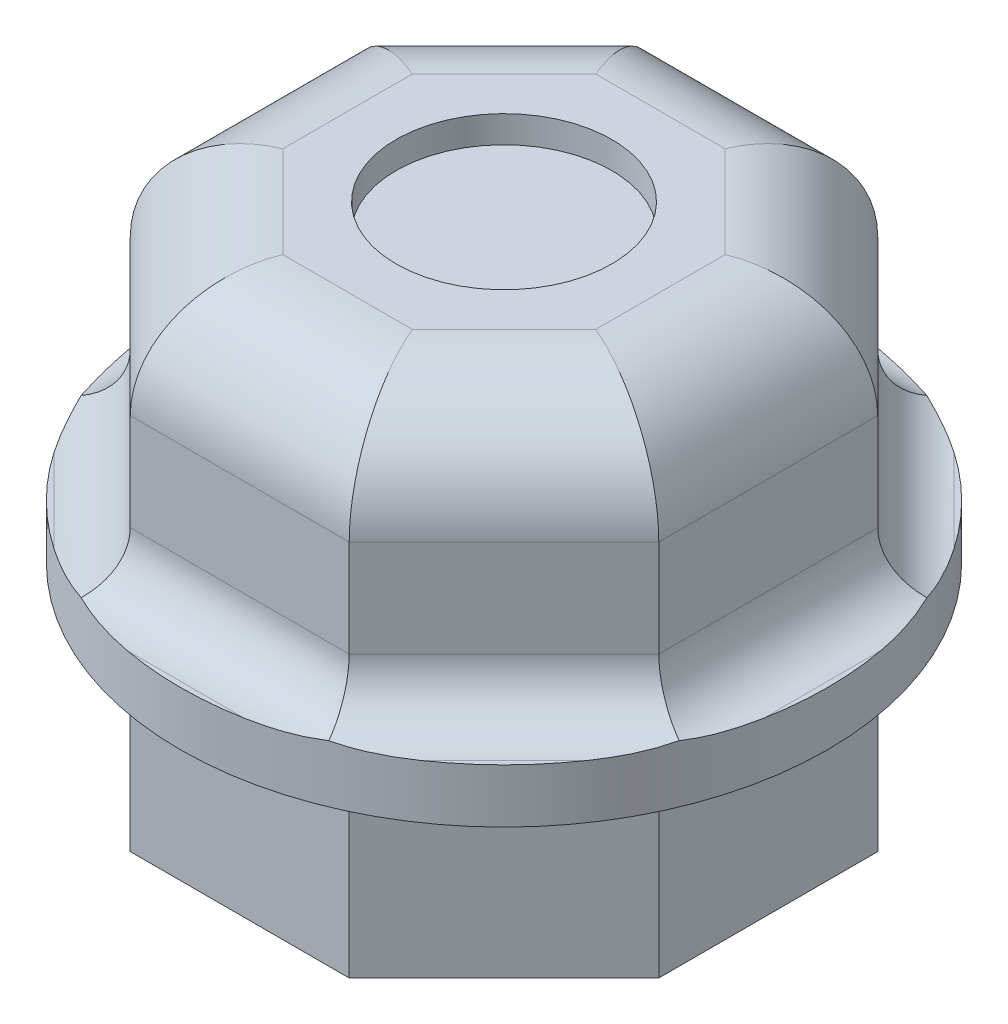
from build123d import *

# Parameters (mm, degrees)
BOSS_EXTRUDE1_DEPTH = 9
SKETCH2_R           = 2
CUT_EXTRUDE1_DEPTH  = 0.5
BOSS_EXTRUDE2_START = -3.2
SKETCH3_R           = 6
BOSS_EXTRUDE2_DEPTH = 1
FILLET1_R           = 2
FILLET2_R           = 1


with BuildPart() as part:
    # Sketch1 → Boss-Extrude1 (new body)
    with BuildSketch(Plane(origin=(0, 0, 0), x_dir=(1, 0, 0), z_dir=(0, 1, 0))):
        Polygon((2.029646456, 4.9), (-2.029646456, 4.9), (-4.9, 2.029646456), (-4.9, -2.029646456), (-2.029646456, -4.9), (2.029646456, -4.9), (4.9, -2.029646456), (4.9, 2.029646456), align=None)
    extrude(amount=BOSS_EXTRUDE1_DEPTH)

    # Sketch2 → Cut-Extrude1 (cut)
    with BuildSketch(Plane(origin=(0, 9, 0), x_dir=(1, 0, 0), z_dir=(0, 1, 0))):
        with Locations(Location((0, 0, 0), (0, 0, 270))):
            Circle(SKETCH2_R)
    extrude(amount=-CUT_EXTRUDE1_DEPTH, mode=Mode.SUBTRACT)

    # Sketch3 → Boss-Extrude2 (add)
    with BuildSketch(Plane.XZ.offset(BOSS_EXTRUDE2_START)):
        with Locations(Location((0, 0, 0), (0, 0, 270))):
            Circle(SKETCH3_R)
    extrude(amount=-BOSS_EXTRUDE2_DEPTH)

    # Fillet1
    fillet1_edges = [part.edges().sort_by_distance(p)[0] for p in [
        (-3.464823228, 9, -3.464823228),
        (-4.9, 9, 0),
        (-3.464823228, 9, 3.464823228),
        (0, 9, 4.9),
        (3.464823228, 9, 3.464823228),
        (4.9, 9, 0),
        (3.464823228, 9, -3.464823228),
        (0, 9, -4.9),
    ]]
    fillet(fillet1_edges, radius=FILLET1_R)

    # Fillet2
    # the kernel refuses this fillet: 1 mm, written as the material it adds along each edge
    with BuildSketch(Plane(origin=(4.9, 4.2, -4.529646456), x_dir=(1, 0, 0), z_dir=(0, 0, 1))) as fillet2_piece_1_section:
        with BuildLine():
            CenterArc((FILLET2_R, FILLET2_R), FILLET2_R, 180, 90)
            Line((0, FILLET2_R), (0, 0))
            Line((0, 0), (FILLET2_R, 0))
        make_face()
    fillet2_piece_1 = extrude(amount=9.059292911, mode=Mode.PRIVATE)
    fillet2_piece_1 = split(fillet2_piece_1, bisect_by=Plane(origin=(6.015133886, 4.441621339, -0.91451257), z_dir=(-0.7071067811865472, 0, 0.7071067811865478)), keep=Keep.TOP, mode=Mode.PRIVATE)
    fillet2_piece_1 = split(fillet2_piece_1, bisect_by=Plane(origin=(6.015133886, 4.441621339, 0.91451257), z_dir=(-0.7071067811865478, 0, -0.7071067811865474)), keep=Keep.TOP, mode=Mode.PRIVATE)
    add(fillet2_piece_1)
    with BuildSketch(Plane(origin=(-4.529646456, 4.2, -4.9), x_dir=(0, 1, 0), z_dir=(1, 0, 0))) as fillet2_piece_2_section:
        with BuildLine():
            CenterArc((FILLET2_R, -FILLET2_R), FILLET2_R, 90, 90)
            Line((0, -FILLET2_R), (0, 0))
            Line((0, 0), (FILLET2_R, 0))
        make_face()
    fillet2_piece_2 = extrude(amount=9.059292911, mode=Mode.PRIVATE)
    fillet2_piece_2 = split(fillet2_piece_2, bisect_by=Plane(origin=(-0.91451257, 4.441621339, -6.015133886), z_dir=(0.7071067811865479, 0, 0.7071067811865472)), keep=Keep.TOP, mode=Mode.PRIVATE)
    fillet2_piece_2 = split(fillet2_piece_2, bisect_by=Plane(origin=(0.91451257, 4.441621339, -6.015133886), z_dir=(-0.7071067811865472, 0, 0.7071067811865478)), keep=Keep.TOP, mode=Mode.PRIVATE)
    add(fillet2_piece_2)
    with BuildSketch(Plane(origin=(0.261879503, 4.2, -6.667766953), x_dir=(0.7071067811865472, 0, -0.7071067811865479), z_dir=(0.7071067811865479, 0, 0.7071067811865474))) as fillet2_piece_3_section:
        with BuildLine():
            CenterArc((FILLET2_R, FILLET2_R), FILLET2_R, 180, 90)
            Line((0, FILLET2_R), (0, 0))
            Line((0, 0), (FILLET2_R, 0))
        make_face()
    fillet2_piece_3 = extrude(amount=9.059292911, mode=Mode.PRIVATE)
    fillet2_piece_3 = split(fillet2_piece_3, bisect_by=Plane(origin=(3.606683921, 4.441621339, -4.9), z_dir=(0, 0, 1)), keep=Keep.TOP, mode=Mode.PRIVATE)
    fillet2_piece_3 = split(fillet2_piece_3, bisect_by=Plane(origin=(4.9, 4.441621339, -3.606683921), z_dir=(-1, 0, 0)), keep=Keep.TOP, mode=Mode.PRIVATE)
    add(fillet2_piece_3)
    with BuildSketch(Plane(origin=(6.667766953, 4.2, 0.261879503), x_dir=(0.7071067811865478, 0, 0.7071067811865474), z_dir=(-0.7071067811865474, 0, 0.7071067811865478))) as fillet2_piece_4_section:
        with BuildLine():
            CenterArc((FILLET2_R, FILLET2_R), FILLET2_R, 180, 90)
            Line((0, FILLET2_R), (0, 0))
            Line((0, 0), (FILLET2_R, 0))
        make_face()
    fillet2_piece_4 = extrude(amount=9.059292911, mode=Mode.PRIVATE)
    fillet2_piece_4 = split(fillet2_piece_4, bisect_by=Plane(origin=(4.9, 4.441621339, 3.606683921), z_dir=(-1, 0, 0)), keep=Keep.TOP, mode=Mode.PRIVATE)
    fillet2_piece_4 = split(fillet2_piece_4, bisect_by=Plane(origin=(3.606683921, 4.441621339, 4.9), z_dir=(0, 0, -1)), keep=Keep.TOP, mode=Mode.PRIVATE)
    add(fillet2_piece_4)
    with BuildSketch(Plane(origin=(4.529646456, 4.2, 4.9), x_dir=(0, 0, 1), z_dir=(-1, 0, 0))) as fillet2_piece_5_section:
        with BuildLine():
            CenterArc((FILLET2_R, FILLET2_R), FILLET2_R, 180, 90)
            Line((0, FILLET2_R), (0, 0))
            Line((0, 0), (FILLET2_R, 0))
        make_face()
    fillet2_piece_5 = extrude(amount=9.059292911, mode=Mode.PRIVATE)
    fillet2_piece_5 = split(fillet2_piece_5, bisect_by=Plane(origin=(0.91451257, 4.441621339, 6.015133886), z_dir=(-0.7071067811865478, 0, -0.7071067811865474)), keep=Keep.TOP, mode=Mode.PRIVATE)
    fillet2_piece_5 = split(fillet2_piece_5, bisect_by=Plane(origin=(-0.91451257, 4.441621339, 6.015133886), z_dir=(0.7071067811865471, 0, -0.707106781186548)), keep=Keep.TOP, mode=Mode.PRIVATE)
    add(fillet2_piece_5)
    with BuildSketch(Plane(origin=(-0.261879503, 4.2, 6.667766953), x_dir=(-0.7071067811865471, 0, 0.707106781186548), z_dir=(-0.707106781186548, 0, -0.7071067811865471))) as fillet2_piece_6_section:
        with BuildLine():
            CenterArc((FILLET2_R, FILLET2_R), FILLET2_R, 180, 90)
            Line((0, FILLET2_R), (0, 0))
            Line((0, 0), (FILLET2_R, 0))
        make_face()
    fillet2_piece_6 = extrude(amount=9.059292911, mode=Mode.PRIVATE)
    fillet2_piece_6 = split(fillet2_piece_6, bisect_by=Plane(origin=(-4.9, 4.441621339, 3.606683921), z_dir=(1, 0, 0)), keep=Keep.TOP, mode=Mode.PRIVATE)
    fillet2_piece_6 = split(fillet2_piece_6, bisect_by=Plane(origin=(-3.606683921, 4.441621339, 4.9), z_dir=(0, 0, -1)), keep=Keep.TOP, mode=Mode.PRIVATE)
    add(fillet2_piece_6)
    with BuildSketch(Plane(origin=(-4.9, 4.2, 4.529646456), x_dir=(-1, 0, 0), z_dir=(0, 0, -1))) as fillet2_piece_7_section:
        with BuildLine():
            CenterArc((FILLET2_R, FILLET2_R), FILLET2_R, 180, 90)
            Line((0, FILLET2_R), (0, 0))
            Line((0, 0), (FILLET2_R, 0))
        make_face()
    fillet2_piece_7 = extrude(amount=9.059292911, mode=Mode.PRIVATE)
    fillet2_piece_7 = split(fillet2_piece_7, bisect_by=Plane(origin=(-6.015133886, 4.441621339, -0.91451257), z_dir=(0.7071067811865479, 0, 0.7071067811865472)), keep=Keep.TOP, mode=Mode.PRIVATE)
    fillet2_piece_7 = split(fillet2_piece_7, bisect_by=Plane(origin=(-6.015133886, 4.441621339, 0.91451257), z_dir=(0.7071067811865471, 0, -0.707106781186548)), keep=Keep.TOP, mode=Mode.PRIVATE)
    add(fillet2_piece_7)
    with BuildSketch(Plane(origin=(-6.667766953, 4.2, -0.261879503), x_dir=(0, 1, 0), z_dir=(0.7071067811865472, 0, -0.7071067811865479))) as fillet2_piece_8_section:
        with BuildLine():
            CenterArc((FILLET2_R, -FILLET2_R), FILLET2_R, 90, 90)
            Line((0, -FILLET2_R), (0, 0))
            Line((0, 0), (FILLET2_R, 0))
        make_face()
    fillet2_piece_8 = extrude(amount=9.059292911, mode=Mode.PRIVATE)
    fillet2_piece_8 = split(fillet2_piece_8, bisect_by=Plane(origin=(-3.606683921, 4.441621339, -4.9), z_dir=(0, 0, 1)), keep=Keep.TOP, mode=Mode.PRIVATE)
    fillet2_piece_8 = split(fillet2_piece_8, bisect_by=Plane(origin=(-4.9, 4.441621339, -3.606683921), z_dir=(1, 0, 0)), keep=Keep.TOP, mode=Mode.PRIVATE)
    add(fillet2_piece_8)
    with BuildSketch(Plane(origin=(0.261879503, 4.2, -6.667766953), x_dir=(0.7071067811865472, 0, -0.7071067811865479), z_dir=(0.7071067811865479, 0, 0.7071067811865474))) as fillet2_piece_9a_section:
        with BuildLine():
            CenterArc((FILLET2_R, FILLET2_R), FILLET2_R, 180, 90)
            Line((0, FILLET2_R), (0, 0))
            Line((0, 0), (FILLET2_R, 0))
        make_face()
    fillet2_piece_9a = extrude(amount=9.059292911, mode=Mode.PRIVATE)
    fillet2_piece_9a = fillet2_piece_9a & Plane(origin=(0, 4.443429881, 0), x_dir=(0, 0, -1), z_dir=(0, -1, 0)) * Cylinder(6, 23, mode=Mode.PRIVATE)
    fillet2_piece_9a = split(fillet2_piece_9a, bisect_by=Plane(origin=(4.9, 4.443429881, -1.840690438), z_dir=(1, 0, 0)), keep=Keep.TOP, mode=Mode.PRIVATE)
    with BuildSketch(Plane(origin=(4.9, 4.2, -4.529646456), x_dir=(1, 0, 0), z_dir=(0, 0, 1))) as fillet2_piece_9b_section:
        with BuildLine():
            CenterArc((FILLET2_R, FILLET2_R), FILLET2_R, 180, 90)
            Line((0, FILLET2_R), (0, 0))
            Line((0, 0), (FILLET2_R, 0))
        make_face()
    fillet2_piece_9b = extrude(amount=9.059292911, mode=Mode.PRIVATE)
    fillet2_piece_9b = fillet2_piece_9b & Plane(origin=(0, 4.443429353, 0), x_dir=(0, 0, -1), z_dir=(0, -1, 0)) * Cylinder(6, 23, mode=Mode.PRIVATE)
    fillet2_piece_9b = split(fillet2_piece_9b, bisect_by=Plane(origin=(4.766386863, 4.443429353, -2.163259593), z_dir=(0.7071067811865472, 0, -0.7071067811865478)), keep=Keep.TOP, mode=Mode.PRIVATE)
    fillet2_piece_9 = fillet2_piece_9a & fillet2_piece_9b
    add(fillet2_piece_9)
    with BuildSketch(Plane(origin=(4.9, 4.2, -4.529646456), x_dir=(1, 0, 0), z_dir=(0, 0, 1))) as fillet2_piece_10a_section:
        with BuildLine():
            CenterArc((FILLET2_R, FILLET2_R), FILLET2_R, 180, 90)
            Line((0, FILLET2_R), (0, 0))
            Line((0, 0), (FILLET2_R, 0))
        make_face()
    fillet2_piece_10a = extrude(amount=9.059292911, mode=Mode.PRIVATE)
    fillet2_piece_10a = fillet2_piece_10a & Plane(origin=(0, 4.443429527, 0), x_dir=(0, 0, -1), z_dir=(0, -1, 0)) * Cylinder(6, 23, mode=Mode.PRIVATE)
    fillet2_piece_10a = split(fillet2_piece_10a, bisect_by=Plane(origin=(4.766387172, 4.443429527, 2.163259283), z_dir=(0.7071067811865478, 0, 0.7071067811865474)), keep=Keep.TOP, mode=Mode.PRIVATE)
    with BuildSketch(Plane(origin=(6.667766953, 4.2, 0.261879503), x_dir=(0.7071067811865478, 0, 0.7071067811865474), z_dir=(-0.7071067811865474, 0, 0.7071067811865478))) as fillet2_piece_10b_section:
        with BuildLine():
            CenterArc((FILLET2_R, FILLET2_R), FILLET2_R, 180, 90)
            Line((0, FILLET2_R), (0, 0))
            Line((0, 0), (FILLET2_R, 0))
        make_face()
    fillet2_piece_10b = extrude(amount=9.059292911, mode=Mode.PRIVATE)
    fillet2_piece_10b = fillet2_piece_10b & Plane(origin=(0, 4.443429353, 0), x_dir=(0, 0, -1), z_dir=(0, -1, 0)) * Cylinder(6, 23, mode=Mode.PRIVATE)
    fillet2_piece_10b = split(fillet2_piece_10b, bisect_by=Plane(origin=(4.9, 4.443429353, 1.840688945), z_dir=(1, 0, 0)), keep=Keep.TOP, mode=Mode.PRIVATE)
    fillet2_piece_10 = fillet2_piece_10a & fillet2_piece_10b
    add(fillet2_piece_10)
    with BuildSketch(Plane(origin=(-4.529646456, 4.2, -4.9), x_dir=(0, 1, 0), z_dir=(1, 0, 0))) as fillet2_piece_11a_section:
        with BuildLine():
            CenterArc((FILLET2_R, -FILLET2_R), FILLET2_R, 90, 90)
            Line((0, -FILLET2_R), (0, 0))
            Line((0, 0), (FILLET2_R, 0))
        make_face()
    fillet2_piece_11a = extrude(amount=9.059292911, mode=Mode.PRIVATE)
    fillet2_piece_11a = split(fillet2_piece_11a, bisect_by=Plane(origin=(-2.163259583, 4.443429177, -4.766386873), z_dir=(-0.7071067811865479, 0, -0.7071067811865472)), keep=Keep.TOP, mode=Mode.PRIVATE)
    fillet2_piece_11a = fillet2_piece_11a & Plane(origin=(0, 4.443429177, 0), x_dir=(0, 0, -1), z_dir=(0, -1, 0)) * Cylinder(6, 23, mode=Mode.PRIVATE)
    with BuildSketch(Plane(origin=(-6.667766953, 4.2, -0.261879503), x_dir=(0, 1, 0), z_dir=(0.7071067811865472, 0, -0.7071067811865479))) as fillet2_piece_11b_section:
        with BuildLine():
            CenterArc((FILLET2_R, -FILLET2_R), FILLET2_R, 90, 90)
            Line((0, -FILLET2_R), (0, 0))
            Line((0, 0), (FILLET2_R, 0))
        make_face()
    fillet2_piece_11b = extrude(amount=9.059292911, mode=Mode.PRIVATE)
    fillet2_piece_11b = split(fillet2_piece_11b, bisect_by=Plane(origin=(-1.840689514, 4.443429808, -4.9), z_dir=(0, 0, -1)), keep=Keep.TOP, mode=Mode.PRIVATE)
    fillet2_piece_11b = fillet2_piece_11b & Plane(origin=(0, 4.443429808, 0), x_dir=(0, 0, -1), z_dir=(0, -1, 0)) * Cylinder(6, 23, mode=Mode.PRIVATE)
    fillet2_piece_11 = fillet2_piece_11a & fillet2_piece_11b
    add(fillet2_piece_11)
    with BuildSketch(Plane(origin=(-4.529646456, 4.2, -4.9), x_dir=(0, 1, 0), z_dir=(1, 0, 0))) as fillet2_piece_12a_section:
        with BuildLine():
            CenterArc((FILLET2_R, -FILLET2_R), FILLET2_R, 90, 90)
            Line((0, -FILLET2_R), (0, 0))
            Line((0, 0), (FILLET2_R, 0))
        make_face()
    fillet2_piece_12a = extrude(amount=9.059292911, mode=Mode.PRIVATE)
    fillet2_piece_12a = split(fillet2_piece_12a, bisect_by=Plane(origin=(2.163259191, 4.443429808, -4.766387265), z_dir=(0.7071067811865472, 0, -0.7071067811865478)), keep=Keep.TOP, mode=Mode.PRIVATE)
    fillet2_piece_12a = fillet2_piece_12a & Plane(origin=(0, 4.443429808, 0), x_dir=(0, 0, -1), z_dir=(0, -1, 0)) * Cylinder(6, 23, mode=Mode.PRIVATE)
    with BuildSketch(Plane(origin=(0.261879503, 4.2, -6.667766953), x_dir=(0.7071067811865472, 0, -0.7071067811865479), z_dir=(0.7071067811865479, 0, 0.7071067811865474))) as fillet2_piece_12b_section:
        with BuildLine():
            CenterArc((FILLET2_R, FILLET2_R), FILLET2_R, 180, 90)
            Line((0, FILLET2_R), (0, 0))
            Line((0, 0), (FILLET2_R, 0))
        make_face()
    fillet2_piece_12b = extrude(amount=9.059292911, mode=Mode.PRIVATE)
    fillet2_piece_12b = split(fillet2_piece_12b, bisect_by=Plane(origin=(1.840689039, 4.443429385, -4.9), z_dir=(0, 0, -1)), keep=Keep.TOP, mode=Mode.PRIVATE)
    fillet2_piece_12b = fillet2_piece_12b & Plane(origin=(0, 4.443429385, 0), x_dir=(0, 0, -1), z_dir=(0, -1, 0)) * Cylinder(6, 23, mode=Mode.PRIVATE)
    fillet2_piece_12 = fillet2_piece_12a & fillet2_piece_12b
    add(fillet2_piece_12)
    with BuildSketch(Plane(origin=(6.667766953, 4.2, 0.261879503), x_dir=(0.7071067811865478, 0, 0.7071067811865474), z_dir=(-0.7071067811865474, 0, 0.7071067811865478))) as fillet2_piece_13a_section:
        with BuildLine():
            CenterArc((FILLET2_R, FILLET2_R), FILLET2_R, 180, 90)
            Line((0, FILLET2_R), (0, 0))
            Line((0, 0), (FILLET2_R, 0))
        make_face()
    fillet2_piece_13a = extrude(amount=9.059292911, mode=Mode.PRIVATE)
    fillet2_piece_13a = fillet2_piece_13a & Plane(origin=(0, 4.443429527, 0), x_dir=(0, 0, -1), z_dir=(0, -1, 0)) * Cylinder(6, 23, mode=Mode.PRIVATE)
    fillet2_piece_13a = split(fillet2_piece_13a, bisect_by=Plane(origin=(1.840689383, 4.443429527, 4.9), z_dir=(0, 0, 1)), keep=Keep.TOP, mode=Mode.PRIVATE)
    with BuildSketch(Plane(origin=(4.529646456, 4.2, 4.9), x_dir=(0, 0, 1), z_dir=(-1, 0, 0))) as fillet2_piece_13b_section:
        with BuildLine():
            CenterArc((FILLET2_R, FILLET2_R), FILLET2_R, 180, 90)
            Line((0, FILLET2_R), (0, 0))
            Line((0, 0), (FILLET2_R, 0))
        make_face()
    fillet2_piece_13b = extrude(amount=9.059292911, mode=Mode.PRIVATE)
    fillet2_piece_13b = fillet2_piece_13b & Plane(origin=(0, 4.443429353, 0), x_dir=(0, 0, -1), z_dir=(0, -1, 0)) * Cylinder(6, 23, mode=Mode.PRIVATE)
    fillet2_piece_13b = split(fillet2_piece_13b, bisect_by=Plane(origin=(2.163259593, 4.443429353, 4.766386863), z_dir=(0.7071067811865478, 0, 0.7071067811865474)), keep=Keep.TOP, mode=Mode.PRIVATE)
    fillet2_piece_13 = fillet2_piece_13a & fillet2_piece_13b
    add(fillet2_piece_13)
    with BuildSketch(Plane(origin=(4.529646456, 4.2, 4.9), x_dir=(0, 0, 1), z_dir=(-1, 0, 0))) as fillet2_piece_14a_section:
        with BuildLine():
            CenterArc((FILLET2_R, FILLET2_R), FILLET2_R, 180, 90)
            Line((0, FILLET2_R), (0, 0))
            Line((0, 0), (FILLET2_R, 0))
        make_face()
    fillet2_piece_14a = extrude(amount=9.059292911, mode=Mode.PRIVATE)
    fillet2_piece_14a = fillet2_piece_14a & Plane(origin=(0, 4.443429527, 0), x_dir=(0, 0, -1), z_dir=(0, -1, 0)) * Cylinder(6, 23, mode=Mode.PRIVATE)
    fillet2_piece_14a = split(fillet2_piece_14a, bisect_by=Plane(origin=(-2.163259283, 4.443429527, 4.766387172), z_dir=(-0.7071067811865471, 0, 0.707106781186548)), keep=Keep.TOP, mode=Mode.PRIVATE)
    with BuildSketch(Plane(origin=(-0.261879503, 4.2, 6.667766953), x_dir=(-0.7071067811865471, 0, 0.707106781186548), z_dir=(-0.707106781186548, 0, -0.7071067811865471))) as fillet2_piece_14b_section:
        with BuildLine():
            CenterArc((FILLET2_R, FILLET2_R), FILLET2_R, 180, 90)
            Line((0, FILLET2_R), (0, 0))
            Line((0, 0), (FILLET2_R, 0))
        make_face()
    fillet2_piece_14b = extrude(amount=9.059292911, mode=Mode.PRIVATE)
    fillet2_piece_14b = fillet2_piece_14b & Plane(origin=(0, 4.443429353, 0), x_dir=(0, 0, -1), z_dir=(0, -1, 0)) * Cylinder(6, 23, mode=Mode.PRIVATE)
    fillet2_piece_14b = split(fillet2_piece_14b, bisect_by=Plane(origin=(-1.840688945, 4.443429353, 4.9), z_dir=(0, 0, 1)), keep=Keep.TOP, mode=Mode.PRIVATE)
    fillet2_piece_14 = fillet2_piece_14a & fillet2_piece_14b
    add(fillet2_piece_14)
    with BuildSketch(Plane(origin=(-0.261879503, 4.2, 6.667766953), x_dir=(-0.7071067811865471, 0, 0.707106781186548), z_dir=(-0.707106781186548, 0, -0.7071067811865471))) as fillet2_piece_15a_section:
        with BuildLine():
            CenterArc((FILLET2_R, FILLET2_R), FILLET2_R, 180, 90)
            Line((0, FILLET2_R), (0, 0))
            Line((0, 0), (FILLET2_R, 0))
        make_face()
    fillet2_piece_15a = extrude(amount=9.059292911, mode=Mode.PRIVATE)
    fillet2_piece_15a = fillet2_piece_15a & Plane(origin=(0, 4.443429527, 0), x_dir=(0, 0, -1), z_dir=(0, -1, 0)) * Cylinder(6, 23, mode=Mode.PRIVATE)
    fillet2_piece_15a = split(fillet2_piece_15a, bisect_by=Plane(origin=(-4.9, 4.443429527, 1.840689383), z_dir=(-1, 0, 0)), keep=Keep.TOP, mode=Mode.PRIVATE)
    with BuildSketch(Plane(origin=(-4.9, 4.2, 4.529646456), x_dir=(-1, 0, 0), z_dir=(0, 0, -1))) as fillet2_piece_15b_section:
        with BuildLine():
            CenterArc((FILLET2_R, FILLET2_R), FILLET2_R, 180, 90)
            Line((0, FILLET2_R), (0, 0))
            Line((0, 0), (FILLET2_R, 0))
        make_face()
    fillet2_piece_15b = extrude(amount=9.059292911, mode=Mode.PRIVATE)
    fillet2_piece_15b = fillet2_piece_15b & Plane(origin=(0, 4.443429385, 0), x_dir=(0, 0, -1), z_dir=(0, -1, 0)) * Cylinder(6, 23, mode=Mode.PRIVATE)
    fillet2_piece_15b = split(fillet2_piece_15b, bisect_by=Plane(origin=(-4.766386929, 4.443429385, 2.163259526), z_dir=(-0.7071067811865471, 0, 0.707106781186548)), keep=Keep.TOP, mode=Mode.PRIVATE)
    fillet2_piece_15 = fillet2_piece_15a & fillet2_piece_15b
    add(fillet2_piece_15)
    with BuildSketch(Plane(origin=(-6.667766953, 4.2, -0.261879503), x_dir=(0, 1, 0), z_dir=(0.7071067811865472, 0, -0.7071067811865479))) as fillet2_piece_16a_section:
        with BuildLine():
            CenterArc((FILLET2_R, -FILLET2_R), FILLET2_R, 90, 90)
            Line((0, -FILLET2_R), (0, 0))
            Line((0, 0), (FILLET2_R, 0))
        make_face()
    fillet2_piece_16a = extrude(amount=9.059292911, mode=Mode.PRIVATE)
    fillet2_piece_16a = split(fillet2_piece_16a, bisect_by=Plane(origin=(-4.9, 4.443429177, -1.840688959), z_dir=(-1, 0, 0)), keep=Keep.TOP, mode=Mode.PRIVATE)
    fillet2_piece_16a = fillet2_piece_16a & Plane(origin=(0, 4.443429177, 0), x_dir=(0, 0, -1), z_dir=(0, -1, 0)) * Cylinder(6, 23, mode=Mode.PRIVATE)
    with BuildSketch(Plane(origin=(-4.9, 4.2, 4.529646456), x_dir=(-1, 0, 0), z_dir=(0, 0, -1))) as fillet2_piece_16b_section:
        with BuildLine():
            CenterArc((FILLET2_R, FILLET2_R), FILLET2_R, 180, 90)
            Line((0, FILLET2_R), (0, 0))
            Line((0, 0), (FILLET2_R, 0))
        make_face()
    fillet2_piece_16b = extrude(amount=9.059292911, mode=Mode.PRIVATE)
    fillet2_piece_16b = split(fillet2_piece_16b, bisect_by=Plane(origin=(-4.766387919, 4.443429881, -2.163258537), z_dir=(-0.7071067811865479, 0, -0.7071067811865472)), keep=Keep.TOP, mode=Mode.PRIVATE)
    fillet2_piece_16b = fillet2_piece_16b & Plane(origin=(0, 4.443429881, 0), x_dir=(0, 0, -1), z_dir=(0, -1, 0)) * Cylinder(6, 23, mode=Mode.PRIVATE)
    fillet2_piece_16 = fillet2_piece_16a & fillet2_piece_16b
    add(fillet2_piece_16)


solid = part.part
